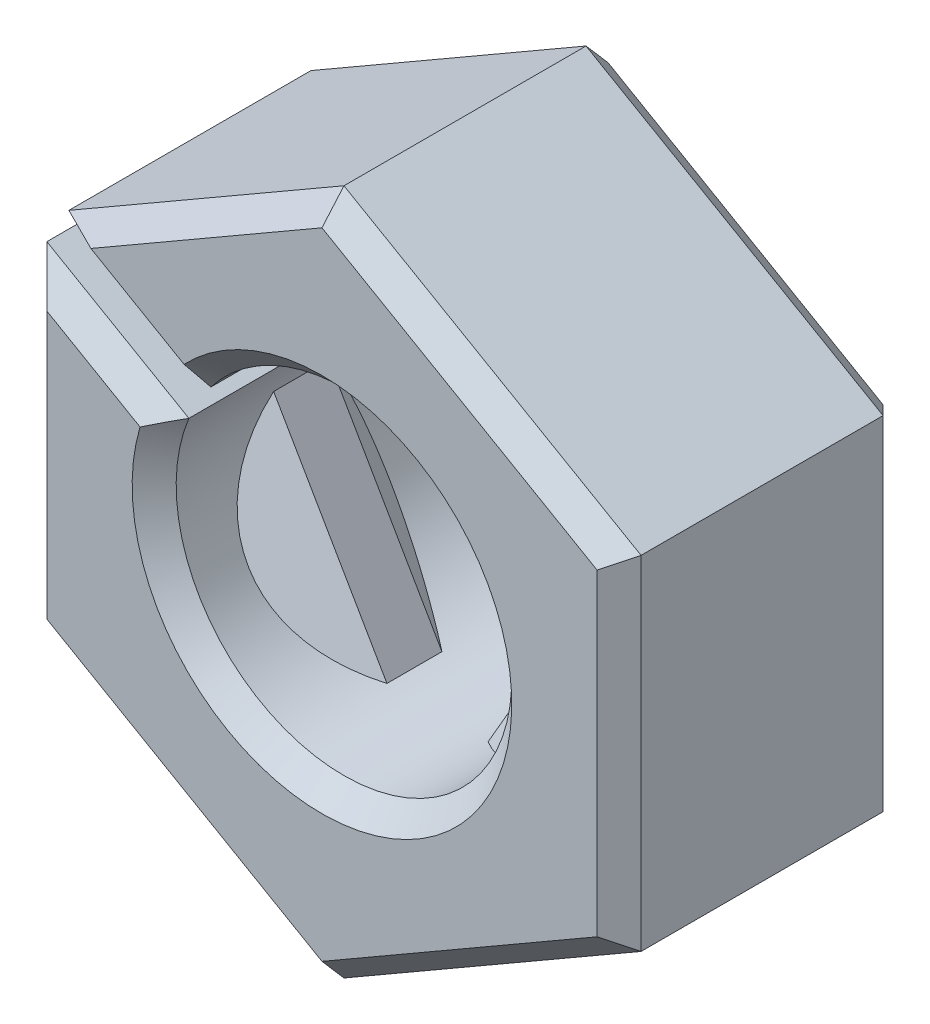
from build123d import *

# Parameters (mm, degrees)
SKETCH1_R              = 1.525
BOSS_EXTRUDE1_DEPTH    = 1.3
CLIP_REACH             = 6.324
CLIP_DIRECTION_2_REACH = 6.324
CLIPS_X3_COUNT         = 3
SPLIT_2_DEPTH          = 5.324349662
SPLIT_2_DEPTH_BACK     = 5.324349662
DEBURS_SIZE            = 0.2


with BuildPart() as part:
    # Sketch1 → Boss-Extrude1 (new, symmetric)
    with BuildSketch(Plane.XY):
        Polygon((2.7, -1.558845727), (2.7, 1.558845727), (0, 3.117691454), (-2.7, 1.558845727), (-2.7, -1.558845727), (0, -3.117691454), align=None)
        Circle(SKETCH1_R, mode=Mode.SUBTRACT)
    extrude(amount=BOSS_EXTRUDE1_DEPTH, both=True)

    # Sketch3 → Clip (add, up to next)
    with BuildSketch(Plane(origin=(0, 0, 0), x_dir=(0, 0, -1), z_dir=(1, 0, 0)), mode=Mode.PRIVATE) as clip_sk1:
        Polygon((-0.65, 1.525), (0.65, 1.525), (0.25, 1.125), (-0.25, 1.125), align=None)
    clip_tool1 = extrude(clip_sk1.sketch, amount=CLIP_REACH, mode=Mode.PRIVATE) - part.part
    clip = clip_tool1.solids().sort_by_distance((0, 1.35463, 0))[0]
    add(clip)

    # Sketch3 → Clip direction 2 (add, up to next)
    with BuildSketch(Plane(origin=(0, 0, 0), x_dir=(0, 0, -1), z_dir=(1, 0, 0)), mode=Mode.PRIVATE) as clip_direction_2_sk1:
        Polygon((-0.65, 1.525), (0.65, 1.525), (0.25, 1.125), (-0.25, 1.125), align=None)
    clip_direction_2_tool1 = extrude(clip_direction_2_sk1.sketch, amount=-CLIP_DIRECTION_2_REACH, mode=Mode.PRIVATE) - part.part
    clip_direction_2 = clip_direction_2_tool1.solids().sort_by_distance((0, 1.35463, 0))[0]
    add(clip_direction_2)

    # Clips x3: Clip, Clip direction 2 ×3 about axis
    clips_x3_axis = Axis((0, 0, 1.3), (0, 0, 1))
    add([clip.rotate(clips_x3_axis, i * 360 / CLIPS_X3_COUNT) for i in range(1, CLIPS_X3_COUNT)])
    add([clip_direction_2.rotate(clips_x3_axis, i * 360 / CLIPS_X3_COUNT) for i in range(1, CLIPS_X3_COUNT)])

    # Sketch4 → Split 2 (cut, two sides: drawn at the far end of the back side and taken through both)
    with BuildSketch(Plane.XY.offset(-SPLIT_2_DEPTH_BACK)):
        Polygon((-2.8, 1.385640646), (-0.1, -0.173205081), (0.1, 0.173205081), (-2.6, 1.732050808), align=None)
    extrude(amount=SPLIT_2_DEPTH + SPLIT_2_DEPTH_BACK, mode=Mode.SUBTRACT)

    # Deburs
    deburs_edges = [part.edges().sort_by_distance(p)[0] for p in [
        (-0.297044023, -1.49579071, -1.3),
        (2.7, 0, -1.3),
        (1.35, 2.33826859, -1.3),
        (-1.25, 2.396003617, -1.3),
        (-2.7, -0.115470054, -1.3),
        (-1.35, -2.33826859, -1.3),
        (1.35, -2.33826859, -1.3),
        (-0.297044023, -1.49579071, 1.3),
        (-1.35, -2.33826859, 1.3),
        (-2.7, -0.115470054, 1.3),
        (-1.25, 2.396003617, 1.3),
        (1.35, 2.33826859, 1.3),
        (2.7, 0, 1.3),
        (1.35, -2.33826859, 1.3),
        (-1.854640884, 1.301717522, -1.3),
        (-2.054640884, 0.95530736, -1.3),
        (-1.854640884, 1.301717522, 1.3),
        (-2.054640884, 0.95530736, 1.3),
    ]]
    chamfer(deburs_edges, length=DEBURS_SIZE)


solid = part.part
